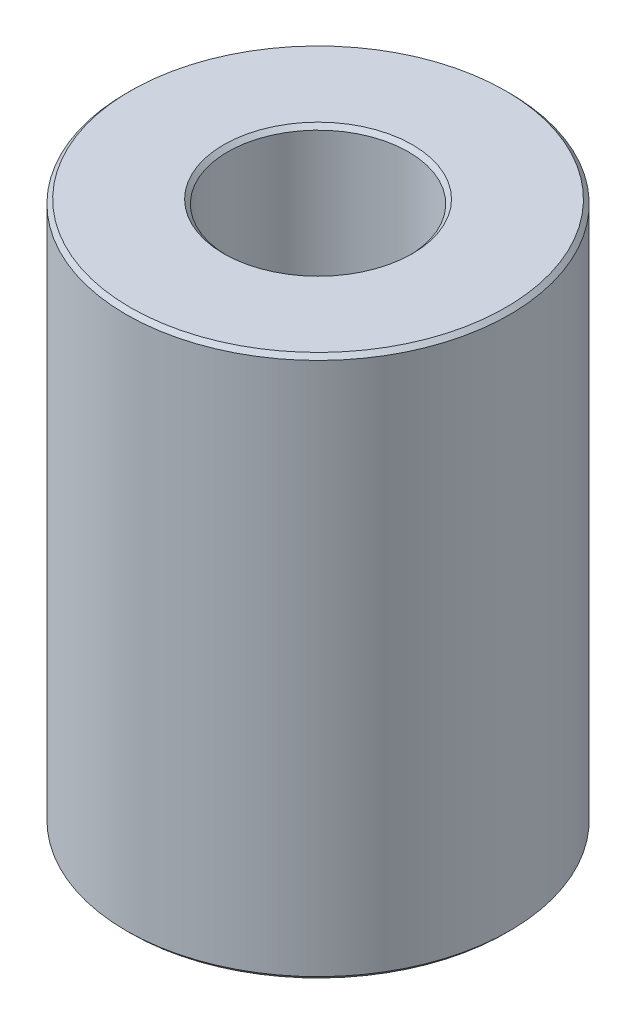
from build123d import *

# Parameters (mm, degrees)
SKETCH1_R           = 12.5
BOSS_EXTRUDE1_DEPTH = 35.319714223
SKETCH2_R           = 5.887898773
CUT_EXTRUDE1_DEPTH  = 40.496610143
CHAMFER1_SIZE       = 0.265261535


with BuildPart() as part:
    # Sketch1 → Boss-Extrude1 (new body)
    with BuildSketch(Plane(origin=(0, 0, 0), x_dir=(1, 0, 0), z_dir=(0, 1, 0))):
        Circle(SKETCH1_R)
    extrude(amount=BOSS_EXTRUDE1_DEPTH)

    # Sketch2 → Cut-Extrude1 (cut, through all)
    with BuildSketch(Plane(origin=(0, 0, 0), x_dir=(1, 0, 0), z_dir=(0, 1, 0))):
        Circle(SKETCH2_R)
    extrude(amount=CUT_EXTRUDE1_DEPTH, mode=Mode.SUBTRACT)

    # Chamfer1
    chamfer1_edges = [part.edges().sort_by_distance(p)[0] for p in [
        (-5.887898773, 35.319714223, 0),
        (-5.887898773, 0, 0),
        (-12.5, 0, 0),
        (-12.5, 35.319714223, 0),
    ]]
    chamfer(chamfer1_edges, length=CHAMFER1_SIZE)


solid = part.part
